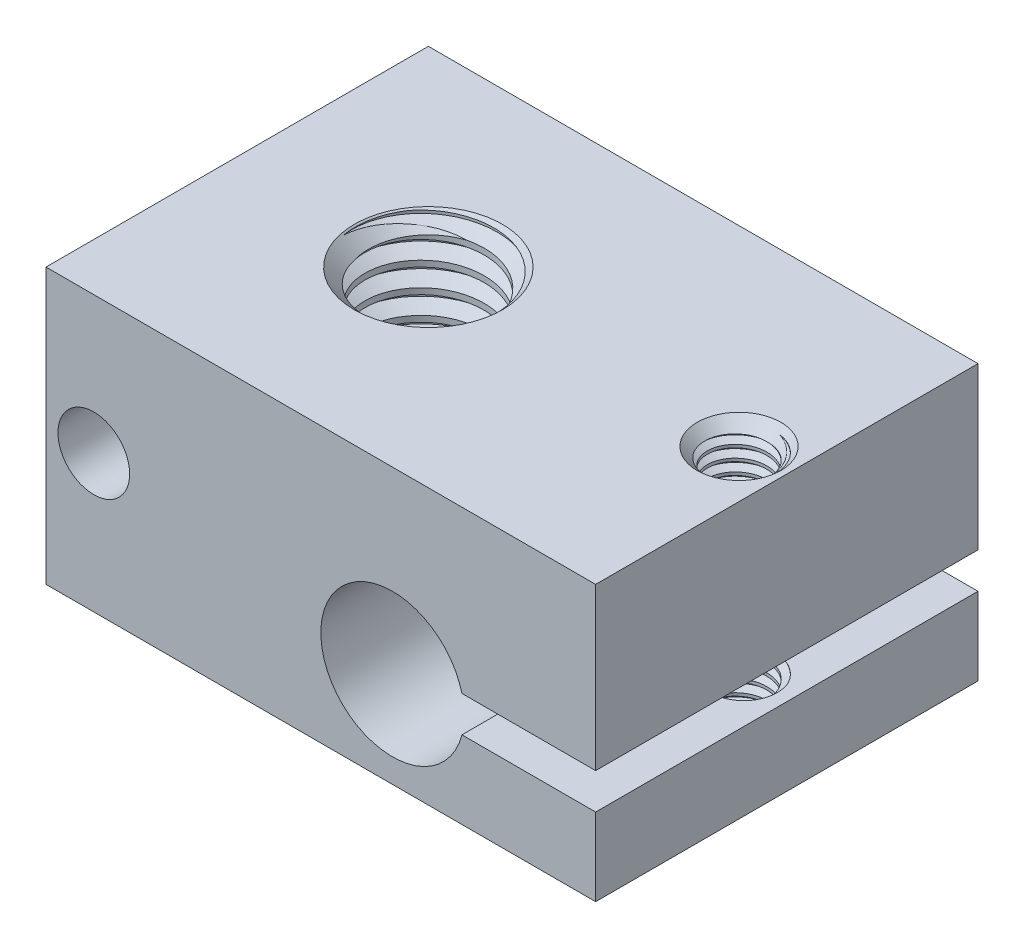
from build123d import *

# Parameters (mm, degrees)
SKETCH1_W           = 23
SKETCH1_H           = 16
SKETCH1_R           = 2.5
BOSS_EXTRUDE1_DEPTH = 11.5
SKETCH3_R           = 1.5
CUT_EXTRUDE1_DEPTH  = 23.814469093
SKETCH2_R           = 1.25
CUT_EXTRUDE2_DEPTH  = 19.12456896
SKETCH2_3_R         = 1.25
CUT_EXTRUDE3_DEPTH  = 5.75
CHAMFER1_SIZE       = 0.6
CHAMFER2_SIZE       = 0.5
THREAD1_PITCH       = 1
THREAD2_PITCH       = 0.5
THREAD3_PITCH       = 0.5


with BuildPart() as part:
    # Sketch1 → Boss-Extrude1 (new body)
    with BuildSketch(Plane(origin=(0, 0, 0), x_dir=(1, 0, 0), z_dir=(0, 1, 0))):
        Rectangle(SKETCH1_W, SKETCH1_H)
        with Locations(Location((-3.5, 0, 0), (0, 0, 270))):
            Circle(SKETCH1_R, mode=Mode.SUBTRACT)
    extrude(amount=BOSS_EXTRUDE1_DEPTH)

    # Sketch3 → Cut-Extrude1 (cut, through all)
    with BuildSketch(Plane.XY.offset(8)):
        with Locations((-9.5, 5.75)):
            Circle(SKETCH3_R)
        with BuildLine():
            Line((5.90473751, 3.25), (11.5, 3.25))
            Line((11.5, 3.25), (11.5, 4.75))
            Line((11.5, 4.75), (5.90473751, 4.75))
            ThreePointArc((5.90473751, 4.75), (0, 4), (5.90473751, 3.25))
        make_face()
    extrude(amount=-CUT_EXTRUDE1_DEPTH, mode=Mode.SUBTRACT)

    # Sketch2 → Cut-Extrude2 (cut, through all)
    with BuildSketch(Plane.XZ):
        with Locations(Location((9.5, 0, 0), (0, 0, 270))):
            Circle(SKETCH2_R)
    extrude(amount=-CUT_EXTRUDE2_DEPTH, mode=Mode.SUBTRACT)

    # Sketch2<3> → Cut-Extrude3 (cut)
    with BuildSketch(Plane.XZ):
        with Locations(Location((-9.5, 0, 0), (0, 0, 270))):
            Circle(SKETCH2_3_R)
    extrude(amount=-CUT_EXTRUDE3_DEPTH, mode=Mode.SUBTRACT)

    # Chamfer1
    chamfer1_edges = [part.edges().sort_by_distance(p)[0] for p in [
        (-3.5, 0, -2.5),
        (-3.5, 11.5, -2.5),
    ]]
    chamfer(chamfer1_edges, length=CHAMFER1_SIZE)

    # Chamfer2
    chamfer2_edges = [part.edges().sort_by_distance(p)[0] for p in [
        (9.5, 11.5, 1.25),
        (9.5, 0, 1.25),
        (-9.5, 0, 1.25),
    ]]
    chamfer(chamfer2_edges, length=CHAMFER2_SIZE)

    # Thread1: arcs per turn and ends read off the stored shape
    # Thread1: the profile of Thread Profile1 profile screwed along a right-hand helix through 20 turns, 8 arcs to a turn; built about Z, then put on its axis
    thread1_z = Axis((0, 0, 0), (0, 0, 1))
    thread1_corners = [(2.4997, 0, -0.000173205), (3.041265875, 0, 0.312499999), (3.041265875, 0, 0.437499999), (2.4997, 0, 0.750173202)]
    with BuildLine(mode=Mode.PRIVATE) as thread1_profile:
        Line(thread1_corners[0], thread1_corners[1])
        Line(thread1_corners[1], thread1_corners[2])
        Line(thread1_corners[2], thread1_corners[3])
        Line(thread1_corners[3], thread1_corners[0])
    thread1_cap = Face(thread1_profile.wire())
    thread1_turn_angles = [0, 22.5, 45, 67.5, 90, 112.5, 135, 157.5, 180, 202.5, 225, 247.5, 270, 292.5, 315, 337.5, 360]
    thread1_turn_weights = [1, 0.9238795325112867, 1, 0.9238795325112867, 1, 0.9238795325112867, 1, 0.9238795325112867, 1, 0.9238795325112867, 1, 0.9238795325112867, 1, 0.9238795325112867, 1, 0.9238795325112867, 1]
    thread1_turn_rails = [Edge.make_bspline([Vector(p[0], p[1], 0).rotate(thread1_z, thread1_turn_angles[k]) / thread1_turn_weights[k] + Vector(0, 0, p[2] + THREAD1_PITCH * thread1_turn_angles[k] / 360) for k in range(17)], [0, 0, 0, 1, 1, 2, 2, 3, 3, 4, 4, 5, 5, 6, 6, 7, 7, 8, 8, 8], 2, thread1_turn_weights) for p in thread1_corners]
    thread1_turn_sides = [Face.make_surface_from_curves(thread1_turn_rails[p[0]], thread1_turn_rails[p[1]]) for p in [(0, 1), (1, 2), (2, 3), (3, 0)]]
    thread1 = Plane(origin=(-3.5, -4.4, 0), x_dir=(1, 0, 0), z_dir=(0, 1, 0)) * Solid(Shell([*[p.moved(Location((0, 0, THREAD1_PITCH * i))) for i in range(20) for p in thread1_turn_sides], thread1_cap, thread1_cap.rotate(thread1_z, 7200).moved(Location((0, 0, THREAD1_PITCH * 7200 / 360)))]))
    add(thread1, mode=Mode.SUBTRACT)

    # Thread2: arcs per turn and ends read off the stored shape
    # Thread2: the profile of Thread Profile2 profile screwed along a right-hand helix through 10 turns, 6 arcs to a turn; built about Z, then put on its axis
    thread2_z = Axis((0, 0, 0), (0, 0, 1))
    thread2_corners = [(1.2497, 0, -0.000173205), (1.520632937, 0, 0.156249999), (1.520632937, 0, 0.218749999), (1.2497, 0, 0.375173204)]
    with BuildLine(mode=Mode.PRIVATE) as thread2_profile:
        Line(thread2_corners[0], thread2_corners[1])
        Line(thread2_corners[1], thread2_corners[2])
        Line(thread2_corners[2], thread2_corners[3])
        Line(thread2_corners[3], thread2_corners[0])
    thread2_cap = Face(thread2_profile.wire())
    thread2_turn_angles = [0, 30, 60, 90, 120, 150, 180, 210, 240, 270, 300, 330, 360]
    thread2_turn_weights = [1, 0.8660254037844387, 1, 0.8660254037844387, 1, 0.8660254037844387, 1, 0.8660254037844387, 1, 0.8660254037844387, 1, 0.8660254037844387, 1]
    thread2_turn_rails = [Edge.make_bspline([Vector(p[0], p[1], 0).rotate(thread2_z, thread2_turn_angles[k]) / thread2_turn_weights[k] + Vector(0, 0, p[2] + THREAD2_PITCH * thread2_turn_angles[k] / 360) for k in range(13)], [0, 0, 0, 1, 1, 2, 2, 3, 3, 4, 4, 5, 5, 6, 6, 6], 2, thread2_turn_weights) for p in thread2_corners]
    thread2_turn_sides = [Face.make_surface_from_curves(thread2_turn_rails[p[0]], thread2_turn_rails[p[1]]) for p in [(0, 1), (1, 2), (2, 3), (3, 0)]]
    thread2 = Plane(origin=(-9.5, -0.5, 0), x_dir=(1, 0, 0), z_dir=(0, 1, 0)) * Solid(Shell([*[p.moved(Location((0, 0, THREAD2_PITCH * i))) for i in range(10) for p in thread2_turn_sides], thread2_cap, thread2_cap.rotate(thread2_z, 3600).moved(Location((0, 0, THREAD2_PITCH * 3600 / 360)))]))
    add(thread2, mode=Mode.SUBTRACT)

    # Thread3: arcs per turn and ends read off the stored shape
    # Thread3: the profile of Thread Profile3 profile screwed along a right-hand helix through 30 turns, 6 arcs to a turn; built about Z, then put on its axis
    thread3_z = Axis((0, 0, 0), (0, 0, 1))
    thread3_corners = [(1.2497, 0, -0.000173205), (1.520632937, 0, 0.156249999), (1.520632937, 0, 0.218749999), (1.2497, 0, 0.375173204)]
    with BuildLine(mode=Mode.PRIVATE) as thread3_profile:
        Line(thread3_corners[0], thread3_corners[1])
        Line(thread3_corners[1], thread3_corners[2])
        Line(thread3_corners[2], thread3_corners[3])
        Line(thread3_corners[3], thread3_corners[0])
    thread3_cap = Face(thread3_profile.wire())
    thread3_turn_angles = [0, 30, 60, 90, 120, 150, 180, 210, 240, 270, 300, 330, 360]
    thread3_turn_weights = [1, 0.8660254037844387, 1, 0.8660254037844387, 1, 0.8660254037844387, 1, 0.8660254037844387, 1, 0.8660254037844387, 1, 0.8660254037844387, 1]
    thread3_turn_rails = [Edge.make_bspline([Vector(p[0], p[1], 0).rotate(thread3_z, thread3_turn_angles[k]) / thread3_turn_weights[k] + Vector(0, 0, p[2] + THREAD3_PITCH * thread3_turn_angles[k] / 360) for k in range(13)], [0, 0, 0, 1, 1, 2, 2, 3, 3, 4, 4, 5, 5, 6, 6, 6], 2, thread3_turn_weights) for p in thread3_corners]
    thread3_turn_sides = [Face.make_surface_from_curves(thread3_turn_rails[p[0]], thread3_turn_rails[p[1]]) for p in [(0, 1), (1, 2), (2, 3), (3, 0)]]
    thread3 = Plane(origin=(9.5, -0.5, 0), x_dir=(1, 0, 0), z_dir=(0, 1, 0)) * Solid(Shell([*[p.moved(Location((0, 0, THREAD3_PITCH * i))) for i in range(30) for p in thread3_turn_sides], thread3_cap, thread3_cap.rotate(thread3_z, 10800).moved(Location((0, 0, THREAD3_PITCH * 10800 / 360)))]))
    add(thread3, mode=Mode.SUBTRACT)


solid = part.part
